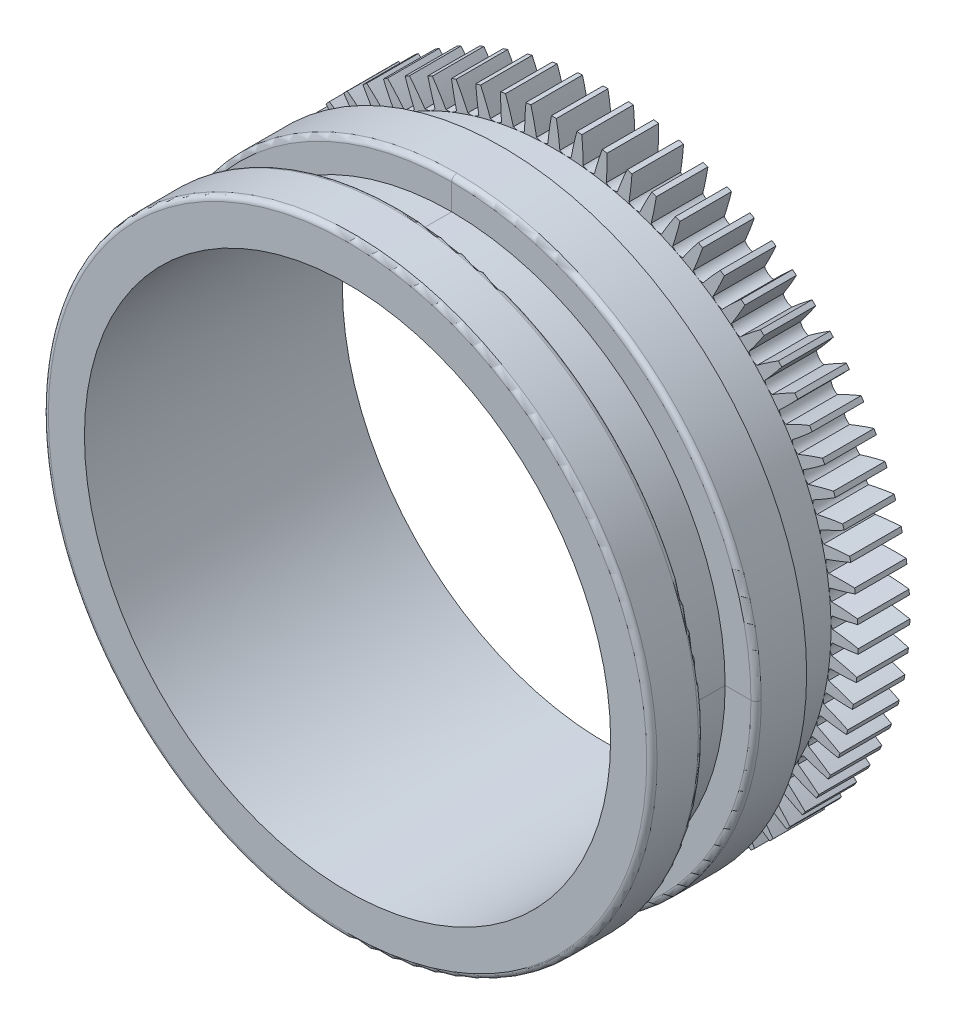
from build123d import *

# Parameters (mm, degrees)
ESQUISSE1_R                  = 29.5
ESQUISSE1_R_2                = 25.5
BOSS_EXTRU_1_DEPTH           = 5
ENL_V_MAT_EXTRU_1_DEPTH      = 43.017853348
R_P_TITION_CIRCULAIRE1_COUNT = 75
ESQUISSE4_R                  = 26.857087404
ESQUISSE4_R_2                = 25.5
BOSS_EXTRU_2_DEPTH           = 5
ESQUISSE5_R                  = 29.5
ESQUISSE5_R_2                = 25.5
BOSS_EXTRU_3_DEPTH           = 15
ESQUISSE6_W                  = 5.1
ESQUISSE6_H                  = 3
CONG_1_R                     = 0.5
CONG_2_R                     = 0.5


with BuildPart() as part:
    # Esquisse1 → Boss.-Extru.1 (new body)
    with BuildSketch(Plane.XY):
        Circle(ESQUISSE1_R)
        Circle(ESQUISSE1_R_2, mode=Mode.SUBTRACT)
    extrude(amount=BOSS_EXTRU_1_DEPTH)

    # Esquisse3 → Enlèv. mat.-Extru.1 (cut, symmetric)
    with BuildSketch(Plane(origin=(0, 0, 5), x_dir=(-1, 0, 0), z_dir=(0, 0, -1))):
        with BuildLine():
            Line((1, -31.5), (-1, -31.5))
            Line((-1, -31.5), (-1, -29.5))
            ThreePointArc((-1, -29.5), (-0.748527954, -28.254764968), (-0.55, -27))
            ThreePointArc((-0.55, -27), (0, -26.857087404), (0.55, -27))
            ThreePointArc((0.55, -27), (0.748527954, -28.254764968), (1, -29.5))
            Line((1, -29.5), (1, -31.5))
        make_face()
    enl_v_mat_extru_1 = extrude(amount=ENL_V_MAT_EXTRU_1_DEPTH, both=True, mode=Mode.SUBTRACT)

    # Répétition circulaire1: Enlèv. mat.-Extru.1 ×75 about axis
    r_p_tition_circulaire1_axis = Axis((0, 0, 5), (0, 0, 1))
    for i in range(1, R_P_TITION_CIRCULAIRE1_COUNT):
        add(enl_v_mat_extru_1.rotate(r_p_tition_circulaire1_axis, i * 360 / R_P_TITION_CIRCULAIRE1_COUNT), mode=Mode.SUBTRACT)

    # Esquisse4 → Boss.-Extru.2 (add)
    with BuildSketch(Plane.XY.offset(5)):
        Circle(ESQUISSE4_R)
        Circle(ESQUISSE4_R_2, mode=Mode.SUBTRACT)
    extrude(amount=BOSS_EXTRU_2_DEPTH)

    # Esquisse5 → Boss.-Extru.3 (add)
    with BuildSketch(Plane.XY.offset(10)):
        Circle(ESQUISSE5_R)
        Circle(ESQUISSE5_R_2, mode=Mode.SUBTRACT)
    extrude(amount=BOSS_EXTRU_3_DEPTH)

    # Enlèvement de matière-Balayage1: sweep along a curve in space
    with BuildLine() as enl_vement_de_mati_re_balayage1_path:
        ThreePointArc((29.5, 0, 25), (20.859650045, 20.859650045, 25), (0, 29.5, 25))
        ThreePointArc((0, 29.5, 25), (-20.859650045, 20.859650045, 25), (-29.5, 0, 25))
        ThreePointArc((-29.5, 0, 25), (-20.859650045, -20.859650045, 25), (0, -29.5, 25))
        ThreePointArc((0, -29.5, 25), (20.859650045, -20.859650045, 25), (29.5, 0, 25))
    # Esquisse6 → Enlèvement de matière-Balayage1 (sweep, cut)
    with BuildSketch(Plane(origin=(0, 0, 0), x_dir=(0, 0, -1), z_dir=(1, 0, 0))):
        with Locations((-17.45, 28)):
            Rectangle(ESQUISSE6_W, ESQUISSE6_H)
    sweep(path=enl_vement_de_mati_re_balayage1_path.line, mode=Mode.SUBTRACT)

    # Congé1
    cong_1_edges = [part.edges().sort_by_distance(p)[0] for p in [
        (-29.5, 0, 20),
        (-29.5, 0, 20),
        (-29.5, 0, 14.9),
        (-29.5, 0, 14.9),
    ]]
    fillet(cong_1_edges, radius=CONG_1_R)

    # Congé2
    cong_2_edges = [part.edges().sort_by_distance(p)[0] for p in [
        (-29.5, 0, 25),
    ]]
    fillet(cong_2_edges, radius=CONG_2_R)


solid = part.part
